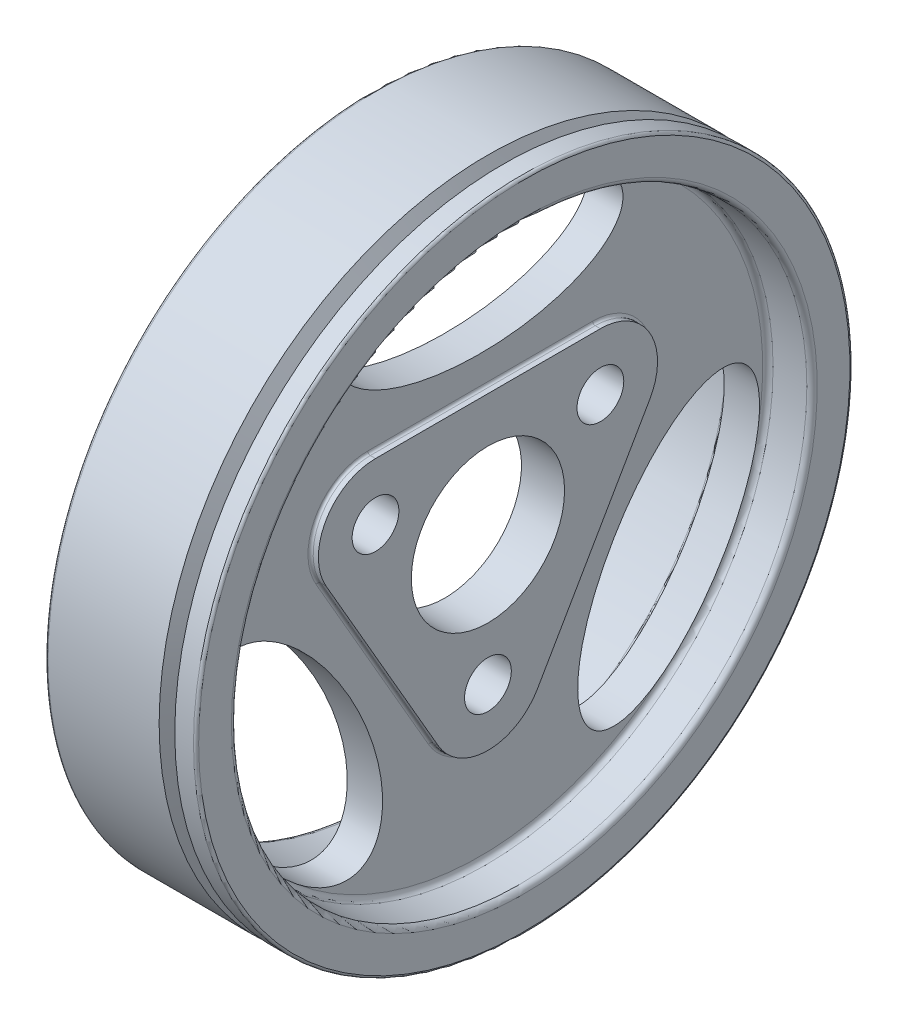
from build123d import *
from build123d.topology import SkipClean

# Parameters (mm, degrees)
FILLET_1_R               = 1
FILLET_2_R               = 0.5
CUT_EXTRUDE_1_DEPTH      = 91.678387723
CUT_EXTRUDE_1_DEPTH_BACK = 91.678387723
SKETCH_3_R               = 4.5
SKETCH_3_RX              = 27.5
SKETCH_3_RY              = 12.5
SKETCH_4_R               = 4.5
SKETCH_4_R_2             = 14.75
EXTRUDE_1_DEPTH          = 1.5
FILLET_3_R               = 0.5
SKETCH_5_R               = 8
CUT_EXTRUDE_2_DEPTH      = 1


with BuildPart() as part:
    # Эскиз1 → Повернуть1 (revolve)
    with BuildSketch(Plane.XY):
        Polygon((13.7, 14.75), (20.5, 14.75), (20.5, 55.4), (29, 55.4), (29, 63.2), (0, 63.2), (0, 55.4), (13.7, 55.4), align=None)
    revolve(axis=Axis((-584.151441429, 0, 0), (1, 0, 0)))

    # Скругление1
    fillet_1_edges = [part.edges().sort_by_distance(p)[0] for p in [
        (0, -55.4, 0),
        (13.7, -55.4, 0),
        (20.5, -55.4, 0),
        (29, -55.4, 0),
    ]]
    fillet(fillet_1_edges, radius=FILLET_1_R)

    # Скругление2
    fillet_2_edges = [part.edges().sort_by_distance(p)[0] for p in [
        (29, -63.2, 0),
        (0, -63.2, 0),
    ]]
    fillet(fillet_2_edges, radius=FILLET_2_R)


with BuildPart() as body_2:
    # Эскиз2 → Повернуть2 (revolve)
    with BuildSketch(Plane(origin=(0, 0, 0), x_dir=(1, 0, 0), z_dir=(0, 1, 0))):
        Polygon((24.9, 63.2), (23.392898208, 60.424263798), (21.885796416, 63.2), align=None)
    revolve(axis=Axis((-584.151441429, 0, 0), (1, 0, 0)))


with BuildPart() as part_1:
    add(part.part)

    # Combine 1: cut body 2
    add(body_2.part, mode=Mode.SUBTRACT)

    # Эскиз3 → Вырез-Вытянуть1 (cut, two sides: drawn at the far end of the back side and taken through both)
    with BuildSketch(Plane.ZY.offset(-13.7).offset(-CUT_EXTRUDE_1_DEPTH_BACK)):
        with Locations((0, -25)):
            Circle(SKETCH_3_R)
        with Locations((-21.650635095, 12.5)):
            Circle(SKETCH_3_R)
        with Locations((21.650635095, 12.5)):
            Circle(SKETCH_3_R)
        with Locations((0, 41.9)):
            Ellipse(SKETCH_3_RX, SKETCH_3_RY)
        with Locations(Location((36.286464419, -20.95), (0, 0, -120))):
            Ellipse(SKETCH_3_RX, SKETCH_3_RY)
        with Locations(Location((-36.286464419, -20.95), (0, 0, 120))):
            Ellipse(SKETCH_3_RX, SKETCH_3_RY)
    extrude(amount=CUT_EXTRUDE_1_DEPTH + CUT_EXTRUDE_1_DEPTH_BACK, mode=Mode.SUBTRACT)

    # Эскиз4 → Бобышка-Вытянуть1 (add)
    with SkipClean():  # the faces are left unmerged after this step: merging them gives an invalid solid
        with BuildSketch(Plane(origin=(20.5, 0, 0), x_dir=(0, 0, -1), z_dir=(1, 0, 0))):
            with BuildLine():
                Line((-21.650635095, 23.5), (21.650635095, 23.5))
                ThreePointArc((21.650635095, 23.5), (31.176914536, 18), (31.176914536, 7))
                Line((31.176914536, 7), (9.526279442, -30.5))
                ThreePointArc((9.526279442, -30.5), (0, -36), (-9.526279442, -30.5))
                Line((-9.526279442, -30.5), (-31.176914536, 7))
                ThreePointArc((-31.176914536, 7), (-31.176914536, 18), (-21.650635095, 23.5))
            make_face()
            with Locations((21.650635095, 12.5)):
                Circle(SKETCH_4_R, mode=Mode.SUBTRACT)
            with Locations((0, -25)):
                Circle(SKETCH_4_R, mode=Mode.SUBTRACT)
            with Locations((-21.650635095, 12.5)):
                Circle(SKETCH_4_R, mode=Mode.SUBTRACT)
            Circle(SKETCH_4_R_2, mode=Mode.SUBTRACT)
        extrude(amount=EXTRUDE_1_DEPTH)

    # Скругление3
    fillet_3_edges = [part_1.edges().sort_by_distance(p)[0] for p in [
        (20.5, 18, -31.176914536),
        (20.5, -11.75, -20.351596989),
        (20.5, -36, 0),
        (20.5, -11.75, 20.351596989),
        (20.5, 18, 31.176914536),
        (20.5, 23.5, 0),
    ]]
    fillet(fillet_3_edges, radius=FILLET_3_R)

    # Эскиз5 → Вырез-Вытянуть2 (cut)
    with BuildSketch(Plane.ZY.offset(-13.7)):
        with Locations((-21.650635095, 12.5)):
            Circle(SKETCH_5_R)
        with Locations((21.650635095, 12.5)):
            Circle(SKETCH_5_R)
        with Locations((0, -25)):
            Circle(SKETCH_5_R)
    extrude(amount=-CUT_EXTRUDE_2_DEPTH, mode=Mode.SUBTRACT)


solid = part_1.part
